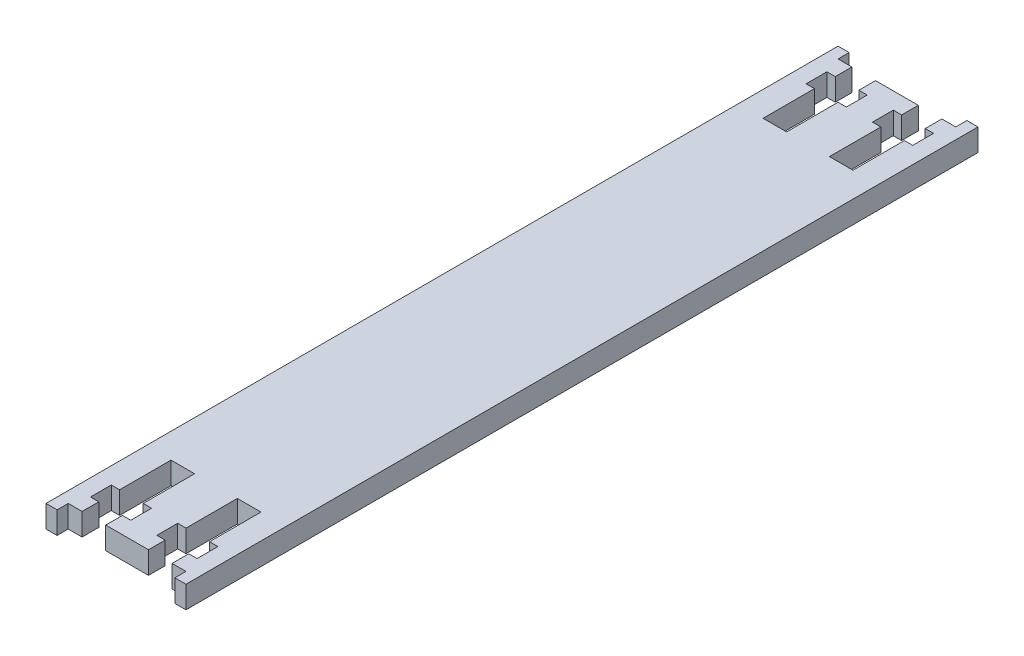
from build123d import *

# Parameters (mm, degrees)
BOSS_EXTRUDE1_DEPTH = 6.35


with BuildPart() as part:
    # Sketch1 → Boss-Extrude1 (new body)
    with BuildSketch(Plane(origin=(0, 0, 0), x_dir=(1, 0, 0), z_dir=(0, 1, 0))):
        Polygon((13.890625, 220), (13.890625, 215.2375), (16.271875, 215.2375), (16.271875, 209.284375), (13.890625, 209.284375), (13.890625, 194.6), (7.14375, 194.6), (7.14375, 209.284375), (4.7625, 209.284375), (4.7625, 215.2375), (7.14375, 215.2375), (7.14375, 220), (3.175, 220), (3.175, 223.175), (0, 223.175), (0, 220), (0, 0), (0, -3.175), (3.175, -3.175), (3.175, 0), (7.14375, 0), (7.14375, 4.7625), (4.7625, 4.7625), (4.7625, 10.715625), (7.14375, 10.715625), (7.14375, 25.4), (13.890625, 25.4), (13.890625, 10.715625), (16.271875, 10.715625), (16.271875, 4.7625), (13.890625, 4.7625), (13.890625, 0), (26.109375, 0), (26.109375, 4.7625), (23.728125, 4.7625), (23.728125, 10.715625), (26.109375, 10.715625), (26.109375, 25.4), (32.85625, 25.4), (32.85625, 10.715625), (35.2375, 10.715625), (35.2375, 4.7625), (32.85625, 4.7625), (32.85625, 0), (36.825, 0), (36.825, -3.175), (40, -3.175), (40, 0), (40, 220), (40, 223.175), (36.825, 223.175), (36.825, 220), (32.85625, 220), (32.85625, 215.2375), (35.2375, 215.2375), (35.2375, 209.284375), (32.85625, 209.284375), (32.85625, 194.6), (26.109375, 194.6), (26.109375, 209.284375), (23.728125, 209.284375), (23.728125, 215.2375), (26.109375, 215.2375), (26.109375, 220), align=None)
    extrude(amount=BOSS_EXTRUDE1_DEPTH)


solid = part.part
